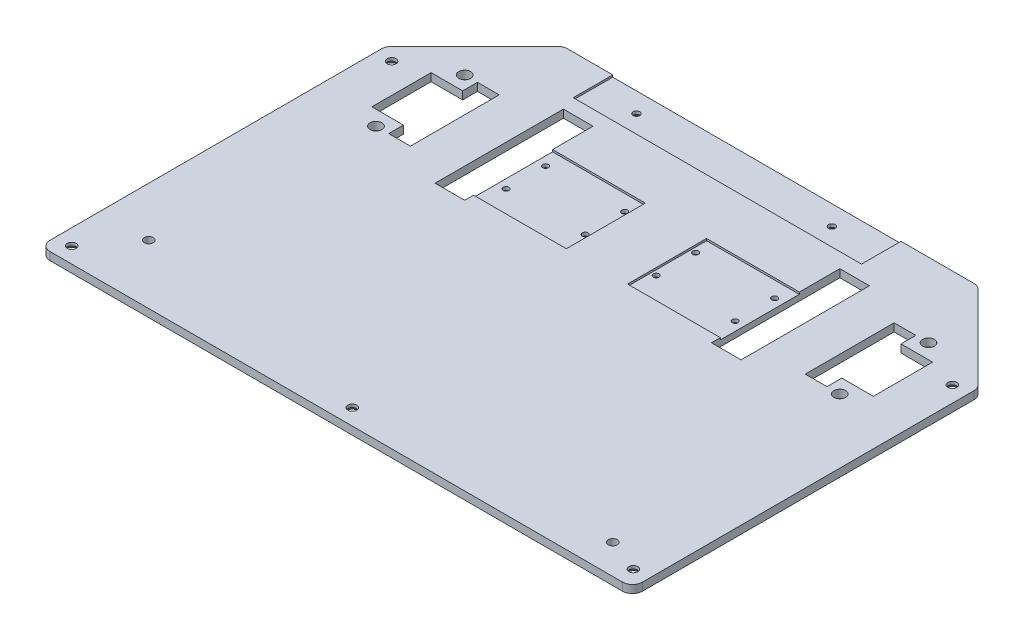
from build123d import *

# Parameters (mm, degrees)
MAIN_EXTRUSION_DEPTH                             = 4
CORNER_LEAVE_R                                   = 5
ESQUISSE2_R                                      = 3
ESQUISSE2_W                                      = 15
ESQUISSE2_H                                      = 65
ENL_V_MAT_EXTRU_1_DEPTH                          = 267.30058205
D_GAGEMENT_M41_D                                 = 4.5
ESQUISSE23_W                                     = 47
ESQUISSE23_H                                     = 40
ENL_V_MAT_EXTRU_2_DEPTH                          = 1
ESQUISSE24_R                                     = 1
ENL_V_MAT_EXTRU_3_DEPTH                          = 267.287438682
FRAISAGE_POUR_VIS_T_TE_FRAIS_E_M2_51_D           = 2.9
FRAISAGE_POUR_VIS_T_TE_FRAIS_E_M2_51_CSINK_D     = 5.5
FRAISAGE_POUR_VIS_T_TE_FRAIS_E_M2_51_CSINK_ANGLE = 90
FRAISAGE_POUR_VIS_T_TE_FRAIS_E_M41_AT_COUNT      = 2
FRAISAGE_POUR_VIS_T_TE_FRAIS_E_M41_AT_PITCH      = 142.035307944
FRAISAGE_POUR_VIS_T_TE_FRAIS_E_M41_2_COUNT       = 2
FRAISAGE_POUR_VIS_T_TE_FRAIS_E_M41_2_PITCH       = 284.035249862
FRAISAGE_POUR_VIS_T_TE_FRAIS_E_M41_3_COUNT       = 2
FRAISAGE_POUR_VIS_T_TE_FRAIS_E_M41_3_PITCH       = 326.770782266
FRAISAGE_POUR_VIS_T_TE_FRAIS_E_M41_4_COUNT       = 2
FRAISAGE_POUR_VIS_T_TE_FRAIS_E_M41_4_PITCH       = 161.565191978
ESQUISSE32_W                                     = 146
ESQUISSE32_H                                     = 20
ENL_V_MAT_EXTRU_4_DEPTH                          = 1
ESQUISSE33_R                                     = 1
ENL_V_MAT_EXTRU_5_DEPTH                          = 267.30058205
FRAISAGE_POUR_VIS_T_TE_FRAIS_E_M31_D             = 3.4
FRAISAGE_POUR_VIS_T_TE_FRAIS_E_M31_CSINK_D       = 6.3
FRAISAGE_POUR_VIS_T_TE_FRAIS_E_M31_CSINK_ANGLE   = 90


with BuildPart() as part:
    # Main scetch → Main extrusion (new body)
    with BuildSketch(Plane(origin=(0, 0, 0), x_dir=(1, 0, 0), z_dir=(0, 1, 0))):
        Polygon((-150, 0), (150, 0), (150, 175), (105, 220), (-105, 220), (-150, 175), align=None)
    extrude(amount=MAIN_EXTRUSION_DEPTH)

    # Corner leave
    corner_leave_edges = [part.edges().sort_by_distance(p)[0] for p in [
        (-150, 2, 0),
        (150, 2, -175),
        (105, 2, -220),
        (150, 2, 0),
        (-105, 2, -220),
        (-150, 2, -175),
    ]]
    fillet(corner_leave_edges, radius=CORNER_LEAVE_R)

    # Esquisse2 → Enlèv. mat.-Extru.1 (cut, through all)
    with BuildSketch(Plane(origin=(0, 4, 0), x_dir=(1, 0, 0), z_dir=(0, 1, 0))):
        with Locations((117.47, 182.47)):
            Circle(ESQUISSE2_R)
        with Locations((117.47, 137.53)):
            Circle(ESQUISSE2_R)
        with Locations((-117.47, 137.53)):
            Circle(ESQUISSE2_R)
        with Locations((-117.47, 182.47)):
            Circle(ESQUISSE2_R)
        with Locations((70, 160)):
            Rectangle(ESQUISSE2_W, ESQUISSE2_H)
        Polygon((100, 137.5), (100, 182.5), (111, 182.5), (111, 175), (127, 175), (127, 145), (111, 145), (111, 137.5), align=None)
        Polygon((-111, 137.5), (-111, 145), (-127, 145), (-127, 175), (-111, 175), (-111, 182.5), (-100, 182.5), (-100, 137.5), align=None)
        with Locations((-70, 160)):
            Rectangle(ESQUISSE2_W, ESQUISSE2_H)
    extrude(amount=-ENL_V_MAT_EXTRU_1_DEPTH, mode=Mode.SUBTRACT)

    # Dégagement M41 (through all)
    with Locations(Plane(origin=(0, 4, 0), x_dir=(1, 0, 0), z_dir=(0, 1, 0))):
        with Locations((-125, 30), (125, 15)):
            Hole(D_GAGEMENT_M41_D / 2)

    # Esquisse23 → Enlèv. mat.-Extru.2 (cut)
    with BuildSketch(Plane(origin=(0, 4, 0), x_dir=(1, 0, 0), z_dir=(0, 1, 0))):
        with Locations((-39, 152)):
            Rectangle(ESQUISSE23_W, ESQUISSE23_H)
    enl_v_mat_extru_2 = extrude(amount=-ENL_V_MAT_EXTRU_2_DEPTH, mode=Mode.SUBTRACT)

    # Esquisse24 → Enlèv. mat.-Extru.3 (cut, through all)
    with BuildSketch(Plane(origin=(0, 3, 0), x_dir=(1, 0, 0), z_dir=(0, 1, 0))):
        with Locations((-58, 164)):
            Circle(ESQUISSE24_R)
        with Locations((-58, 144)):
            Circle(ESQUISSE24_R)
        with Locations((-18, 164)):
            Circle(ESQUISSE24_R)
        with Locations((-18, 144)):
            Circle(ESQUISSE24_R)
    enl_v_mat_extru_3 = extrude(amount=-ENL_V_MAT_EXTRU_3_DEPTH, mode=Mode.SUBTRACT)

    # Fraisage pour vis à tête fraisée M2.51 (through all)
    with Locations(Plane(origin=(0, 0, 0), x_dir=(-1, 0, 0), z_dir=(0, -1, 0))):
        with Locations((18, 164), (58, 164), (58, 144), (18, 144)):
            fraisage_pour_vis_t_te_frais_e_m2_51 = CounterSinkHole(FRAISAGE_POUR_VIS_T_TE_FRAIS_E_M2_51_D / 2, FRAISAGE_POUR_VIS_T_TE_FRAIS_E_M2_51_CSINK_D / 2, counter_sink_angle=FRAISAGE_POUR_VIS_T_TE_FRAIS_E_M2_51_CSINK_ANGLE)

    # Symétrie1: Enlèv. mat.-Extru.2, Enlèv. mat.-Extru.3, Fraisage pour vis à tête fraisée M2.51 across plane
    add(enl_v_mat_extru_2.mirror(Plane(origin=(0, 0, 0), x_dir=(0, 0, 1), z_dir=(1, 0, 0))), mode=Mode.SUBTRACT)
    add(enl_v_mat_extru_3.mirror(Plane(origin=(0, 0, 0), x_dir=(0, 0, 1), z_dir=(1, 0, 0))), mode=Mode.SUBTRACT)
    add(fraisage_pour_vis_t_te_frais_e_m2_51.mirror(Plane(origin=(0, 0, 0), x_dir=(0, 0, 1), z_dir=(1, 0, 0))), mode=Mode.SUBTRACT)

    # Esquisse31 → Fraisage pour vis à tête fraisée M41 (revolve, cut)
    with BuildSketch(Plane(origin=(142.034917049, 0, -8.434811795), x_dir=(0, 0, -1), z_dir=(1, 0, 0))):
        Polygon((0, 0), (0, 4), (2.25, 4), (2.25, 2.45), (4.7, 0), align=None)
    fraisage_pour_vis_t_te_frais_e_m41 = revolve(axis=Axis((142.034917049, -6.35, -8.434811795), (0, 1, 0)), mode=Mode.SUBTRACT)

    # Fraisage pour vis à tête fraisée M41 at: Fraisage pour vis à tête fraisée M41 ×2
    with Locations(*[Vector(-0.9999972478981508, 0, 0.002346102326084912) * (i * FRAISAGE_POUR_VIS_T_TE_FRAIS_E_M41_AT_PITCH) for i in range(1, FRAISAGE_POUR_VIS_T_TE_FRAIS_E_M41_AT_COUNT)]):
        add(fraisage_pour_vis_t_te_frais_e_m41, mode=Mode.SUBTRACT)

    # Fraisage pour vis _ t_te frais_e M41 2: Fraisage pour vis à tête fraisée M41 ×2
    with Locations(*[Vector(-0.9999988282676796, 0, 0.0015308374400840067) * (i * FRAISAGE_POUR_VIS_T_TE_FRAIS_E_M41_2_PITCH) for i in range(1, FRAISAGE_POUR_VIS_T_TE_FRAIS_E_M41_2_COUNT)]):
        add(fraisage_pour_vis_t_te_frais_e_m41, mode=Mode.SUBTRACT)

    # Fraisage pour vis _ t_te frais_e M41 3: Fraisage pour vis à tête fraisée M41 ×2
    with Locations(*[Vector(-0.8692176059291576, 0, -0.4944297255857335) * (i * FRAISAGE_POUR_VIS_T_TE_FRAIS_E_M41_3_PITCH) for i in range(1, FRAISAGE_POUR_VIS_T_TE_FRAIS_E_M41_3_COUNT)]):
        add(fraisage_pour_vis_t_te_frais_e_m41, mode=Mode.SUBTRACT)

    # Fraisage pour vis _ t_te frais_e M41 4: Fraisage pour vis à tête fraisée M41 ×2
    with Locations(*[Vector(-0.00021611739763843655, 0, -0.999999976646635) * (i * FRAISAGE_POUR_VIS_T_TE_FRAIS_E_M41_4_PITCH) for i in range(1, FRAISAGE_POUR_VIS_T_TE_FRAIS_E_M41_4_COUNT)]):
        add(fraisage_pour_vis_t_te_frais_e_m41, mode=Mode.SUBTRACT)

    # Esquisse32 → Enlèv. mat.-Extru.4 (cut)
    with BuildSketch(Plane(origin=(0, 4, 0), x_dir=(1, 0, 0), z_dir=(0, 1, 0))):
        with Locations((-7, 210)):
            Rectangle(ESQUISSE32_W, ESQUISSE32_H)
    extrude(amount=-ENL_V_MAT_EXTRU_4_DEPTH, mode=Mode.SUBTRACT)

    # Esquisse33 → Enlèv. mat.-Extru.5 (cut, through all)
    with BuildSketch(Plane.XZ):
        with Locations((-58, -210)):
            Circle(ESQUISSE33_R)
        with Locations((41, -210)):
            Circle(ESQUISSE33_R)
    extrude(amount=-ENL_V_MAT_EXTRU_5_DEPTH, mode=Mode.SUBTRACT)

    # Fraisage pour vis à tête fraisée M31 (through all)
    with Locations(Plane(origin=(0, 0, 0), x_dir=(-1, 0, 0), z_dir=(0, -1, 0))):
        with Locations((58, 210), (-41, 210)):
            CounterSinkHole(FRAISAGE_POUR_VIS_T_TE_FRAIS_E_M31_D / 2, FRAISAGE_POUR_VIS_T_TE_FRAIS_E_M31_CSINK_D / 2, counter_sink_angle=FRAISAGE_POUR_VIS_T_TE_FRAIS_E_M31_CSINK_ANGLE)


solid = part.part
